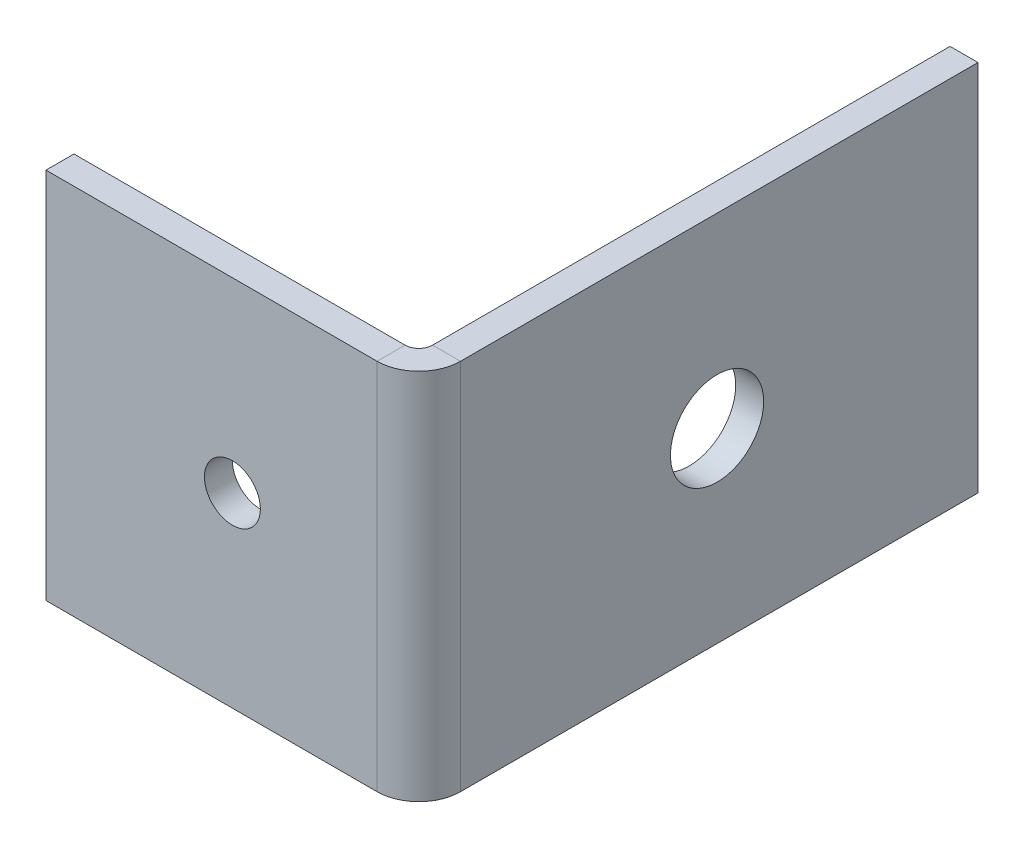
from build123d import *

# Parameters (mm, degrees)
BASE_FLANGE1_DEPTH              = 20
F_5_0MM_PRESS_DOWEL_HOLE1_D     = 5
F_3_0MM_PRESS_DOWEL_HOLE1_D     = 3
F_3_0MM_PRESS_DOWEL_HOLE2_D     = 3
F_3_0MM_PRESS_DOWEL_HOLE2_DEPTH = 6
F_3_0MM_PRESS_DOWEL_HOLE2_TIP   = 0.901290929


# Sheet-metal steps are written as plain solids
with BuildPart() as part:
    # Sketch1 → Base-Flange1 (new body)
    with BuildSketch(Plane(origin=(0, 0, 0), x_dir=(1, 0, 0), z_dir=(0, 1, 0))):
        with BuildLine():
            Line((0, 0), (0, -27.7634))
            ThreePointArc((0, -27.7634), (-0.655084973, -29.344915027), (-2.2366, -30))
            Line((-2.2366, -30), (-20, -30))
            Line((-20, -30), (-20, -28.5))
            Line((-20, -28.5), (-2.2366, -28.5))
            ThreePointArc((-2.2366, -28.5), (-1.715745145, -28.284254855), (-1.5, -27.7634))
            Line((-1.5, -27.7634), (-1.5, 0))
            Line((-1.5, 0), (0, 0))
        make_face()
    extrude(amount=BASE_FLANGE1_DEPTH)

    # Ø5.0mm Press Dowel Hole1 (through all)
    with Locations(Plane(origin=(0, 0, 0), x_dir=(0, 0, -1), z_dir=(1, 0, 0))):
        with Locations((-14, 10)):
            Hole(F_5_0MM_PRESS_DOWEL_HOLE1_D / 2)

    # Ø3.0mm Press Dowel Hole1 (through all)
    with Locations(Plane(origin=(0, 0, 28.5), x_dir=(-1, 0, 0), z_dir=(0, 0, -1))):
        with Locations((10, 10)):
            Hole(F_3_0MM_PRESS_DOWEL_HOLE1_D / 2)

    # Ø3.0mm Press Dowel Hole2
    with Locations(Plane(origin=(-166.531359221, -210.525513363, 30), x_dir=(0, 1, 0), z_dir=(0, 0, -1))):
        with Locations((220.525513363, 156.531359221), (102.525513363, 181.531359221), (102.525513363, 271.531359221), (89.19270005, 226.531359221), (210.525513363, 317.793651488), (230.525513363, 317.793651488), (252.525513363, 320.462332131), (232.525513363, 300.462332131), (252.525513363, 132.600386311), (232.525513363, 152.600386311), (111.286271896, 136.531359221), (91.286271896, 136.531359221), (41.525513363, 196.432813402), (13.525513363, 196.432813402), (41.525513363, 138.767959221), (13.525513363, 138.767959221), (41.525513363, 256.62990504), (13.525513363, 256.62990504), (41.525513363, 314.294759221), (13.525513363, 314.294759221)):
            Hole(F_3_0MM_PRESS_DOWEL_HOLE2_D / 2, depth=F_3_0MM_PRESS_DOWEL_HOLE2_DEPTH)
            with Locations((0, 0, -(F_3_0MM_PRESS_DOWEL_HOLE2_DEPTH + F_3_0MM_PRESS_DOWEL_HOLE2_TIP / 2))):  # 118° drill point
                Cone(0, F_3_0MM_PRESS_DOWEL_HOLE2_D / 2, F_3_0MM_PRESS_DOWEL_HOLE2_TIP, mode=Mode.SUBTRACT)


solid = part.part
